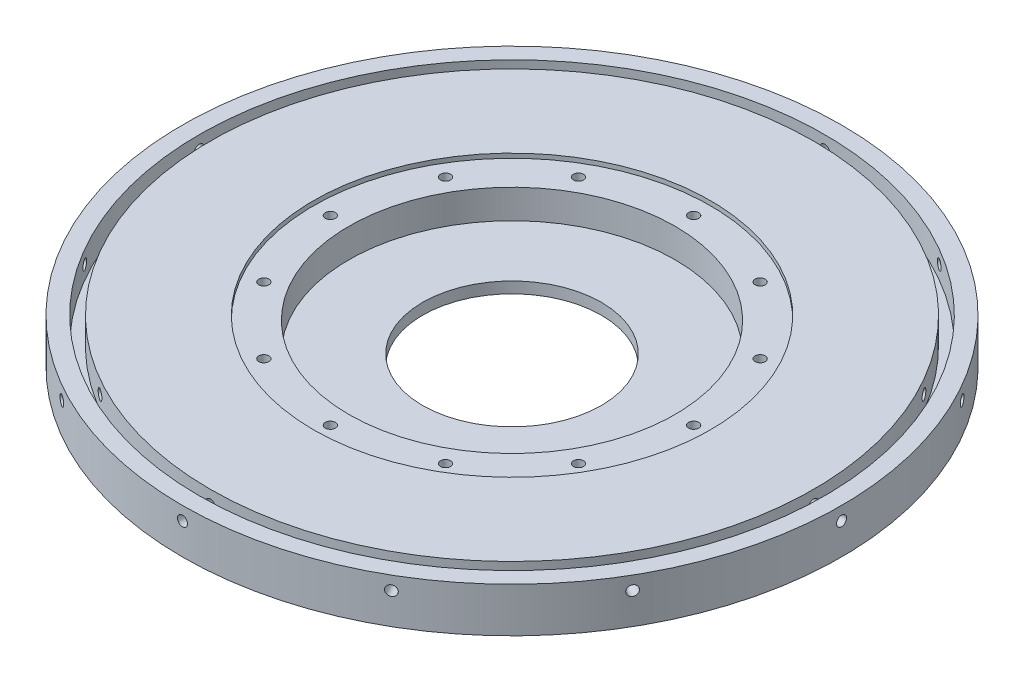
from build123d import *

# Parameters (mm, degrees)
SKETCH1_W           = 127.635
SKETCH1_H           = 127.635
BOSS_EXTRUDE1_DEPTH = 9.525
SKETCH13_R          = 93.6625
BOSS_EXTRUDE2_DEPTH = 12.7
SKETCH5_R           = 46.355
CUT_EXTRUDE1_DEPTH  = 9.525
SKETCH11_R          = 1.4351
CUT_EXTRUDE3_DEPTH  = 224.072165005
CIRPATTERN1_COUNT   = 12
SKETCH12_R          = 56.41975
CUT_EXTRUDE4_DEPTH  = 1.27
SKETCH16_R          = 88.9
SKETCH16_R_2        = 85.725
CUT_EXTRUDE5_DEPTH  = 7.62
SKETCH17_R          = 1.4351
CUT_EXTRUDE6_DEPTH  = 15.24
CIRPATTERN2_COUNT   = 12
SKETCH19_R          = 25.4
CUT_EXTRUDE7_DEPTH  = 87.63


with BuildPart() as part:
    # Sketch1 → Boss-Extrude1 (new body)
    with BuildSketch(Plane(origin=(0, 0, 0), x_dir=(1, 0, 0), z_dir=(0, 1, 0))):
        with Locations((63.8175, 63.8175)):
            Rectangle(SKETCH1_W, SKETCH1_H)
    extrude(amount=BOSS_EXTRUDE1_DEPTH)

    # Sketch13 → Boss-Extrude2 (add)
    with BuildSketch(Plane(origin=(0, 9.525, 0), x_dir=(1, 0, 0), z_dir=(0, 1, 0))):
        with Locations((63.8175, 63.8175)):
            Circle(SKETCH13_R)
    extrude(amount=-BOSS_EXTRUDE2_DEPTH)

    # Sketch5 → Cut-Extrude1 (cut)
    with BuildSketch(Plane(origin=(0, 9.525, 0), x_dir=(1, 0, 0), z_dir=(0, 1, 0))):
        with Locations((63.8175, 63.8175)):
            Circle(SKETCH5_R)
        with Locations((63.8175, 63.8175)):
            Circle(SKETCH5_R)
    extrude(amount=-CUT_EXTRUDE1_DEPTH, mode=Mode.SUBTRACT)

    # Sketch11 → Cut-Extrude3 (cut, through all)
    with BuildSketch(Plane(origin=(0, 9.525, 0), x_dir=(1, 0, 0), z_dir=(0, 1, 0))):
        with Locations((63.8175, 115.443)):
            Circle(SKETCH11_R)
    cut_extrude3 = extrude(amount=-CUT_EXTRUDE3_DEPTH, mode=Mode.SUBTRACT)

    # CirPattern1: Cut-Extrude3 ×12 about axis
    cirpattern1_axis = Axis((63.8175, 9.525, -63.8175), (0, 1, 0))
    for i in range(1, CIRPATTERN1_COUNT):
        add(cut_extrude3.rotate(cirpattern1_axis, i * 360 / CIRPATTERN1_COUNT), mode=Mode.SUBTRACT)

    # Sketch12 → Cut-Extrude4 (cut)
    with BuildSketch(Plane(origin=(0, 9.525, 0), x_dir=(1, 0, 0), z_dir=(0, 1, 0))):
        with Locations((63.8175, 63.8175)):
            Circle(SKETCH12_R)
    extrude(amount=-CUT_EXTRUDE4_DEPTH, mode=Mode.SUBTRACT)

    # Sketch16 → Cut-Extrude5 (cut)
    with BuildSketch(Plane(origin=(0, 9.525, 0), x_dir=(1, 0, 0), z_dir=(0, 1, 0))):
        with Locations((63.8175, 63.8175)):
            Circle(SKETCH16_R)
        with Locations((63.8175, 63.8175)):
            Circle(SKETCH16_R_2, mode=Mode.SUBTRACT)
    extrude(amount=-CUT_EXTRUDE5_DEPTH, mode=Mode.SUBTRACT)

    # Sketch17 → Cut-Extrude6 (cut)
    with BuildSketch(Plane.XY.offset(29.845)):
        with Locations((63.8175, 5.715)):
            Circle(SKETCH17_R)
    cut_extrude6 = extrude(amount=-CUT_EXTRUDE6_DEPTH, mode=Mode.SUBTRACT)

    # CirPattern2: Cut-Extrude6 ×12 about axis
    cirpattern2_axis = Axis((63.8175, -3.175, -63.8175), (0, 1, 0))
    for i in range(1, CIRPATTERN2_COUNT):
        add(cut_extrude6.rotate(cirpattern2_axis, i * 360 / CIRPATTERN2_COUNT), mode=Mode.SUBTRACT)

    # Sketch19 → Cut-Extrude7 (cut)
    with BuildSketch(Plane.XZ.offset(3.175)):
        with Locations((63.8175, -63.8175)):
            Circle(SKETCH19_R)
    extrude(amount=-CUT_EXTRUDE7_DEPTH, mode=Mode.SUBTRACT)


solid = part.part
